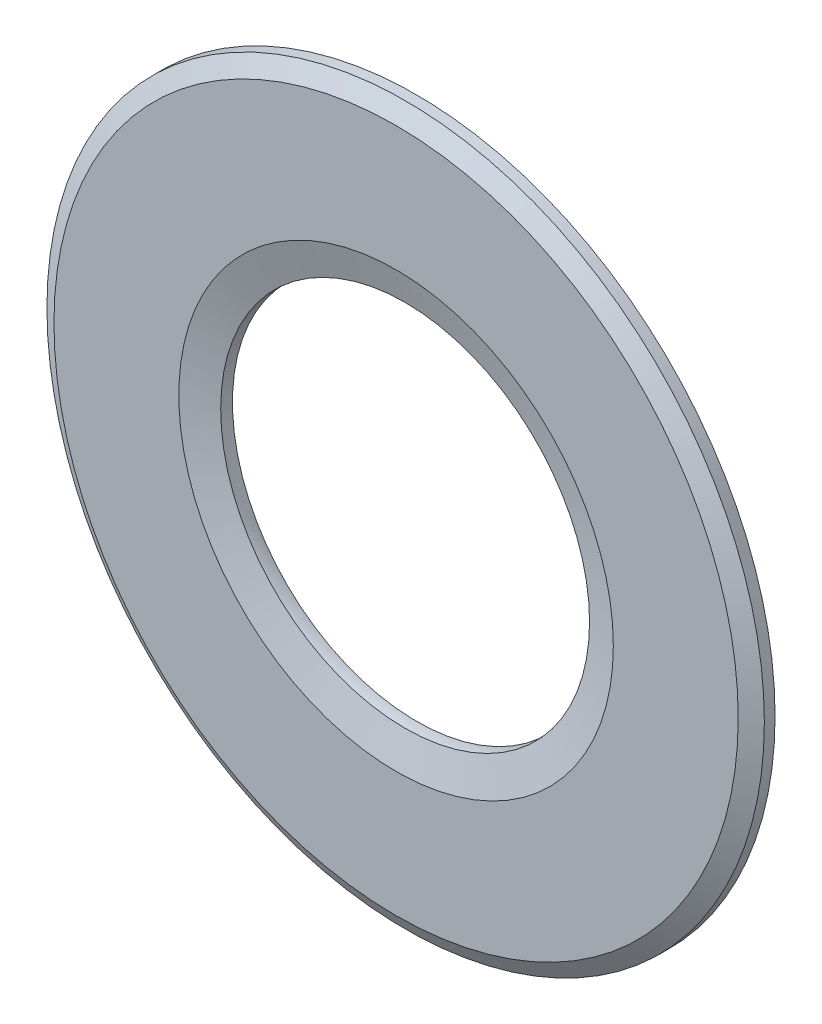
from build123d import *
from OCP.BRepFilletAPI import BRepFilletAPI_MakeChamfer

# Parameters (mm, degrees)
BOSS_EXTRUDE1_DEPTH      = 0.39624
BOSS_EXTRUDE1_DEPTH_BACK = 0.39624
SKETCH3_R                = 9.525
SKETCH3_R_2              = 4.8895
CHAMFER1_SIZE            = 0.254
CHAMFER1_SIZE2           = 0.439940905
CHAMFER2_SIZE            = 0.828943919


with BuildPart() as part:
    # Sketch3 → Boss-Extrude1 (new, two sides: drawn at the far end of the back side and taken through both)
    with BuildSketch(Plane.XY.offset(-BOSS_EXTRUDE1_DEPTH_BACK)):
        Circle(SKETCH3_R)
        Circle(SKETCH3_R_2, mode=Mode.SUBTRACT)
    extrude(amount=BOSS_EXTRUDE1_DEPTH + BOSS_EXTRUDE1_DEPTH_BACK)

    # Chamfer1: one chamfer whose edges measure the first distance from different faces: ONE call of the kernel's chamfer builder (chamfer() names one face for all edges)
    chamfer1_edges_1 = [part.edges().sort_by_distance(p)[0] for p in [
        (-9.525, 0, 0.39624),
    ]]
    chamfer1_side_1 = [part.faces().sort_by_distance(p)[0] for p in [
        (-9.525, 0, 0.19812),
    ]]
    chamfer1_edges_2 = [part.edges().sort_by_distance(p)[0] for p in [
        (-9.525, 0, -0.39624),
    ]]
    chamfer1_side_2 = [part.faces().sort_by_distance(p)[0] for p in [
        (-9.525, 0, -0.19812),
    ]]
    chamfer1 = BRepFilletAPI_MakeChamfer(part.part.solid().wrapped)
    for e in chamfer1_edges_1:
        chamfer1.Add(CHAMFER1_SIZE, CHAMFER1_SIZE2, e.wrapped, chamfer1_side_1[0].wrapped)  # the first distance lies on this face
    for e in chamfer1_edges_2:
        chamfer1.Add(CHAMFER1_SIZE, CHAMFER1_SIZE2, e.wrapped, chamfer1_side_2[0].wrapped)  # the first distance lies on this face
    add(Compound.cast(chamfer1.Shape()), mode=Mode.REPLACE)

    # Sketch4 → Cut-Revolve1 (revolve, cut)
    with BuildSketch(Plane(origin=(0, 0, 0), x_dir=(0, 0, -1), z_dir=(1, 0, 0)), mode=Mode.PRIVATE) as cut_revolve1_sk:
        with BuildLine():
            Line((-0.39624, 4.8387), (-0.39624, 4.9403))
            ThreePointArc((-0.39624, 4.9403), (0, 4.8895), (0.39624, 4.9403))
            Line((0.39624, 4.9403), (0.39624, 4.8387))
            Line((0.39624, 4.8387), (-0.39624, 4.8387))
        make_face()
    revolve(cut_revolve1_sk.sketch.rotate(Axis((0, 0, 0.39624), (0, 0, -1)), 90), axis=Axis((0, 0, 0.39624), (0, 0, -1)), mode=Mode.SUBTRACT)

    # Chamfer2
    # the kernel refuses this chamfer: 0.828943919, 0.254 mm, written as the material it takes off along each edge
    with BuildSketch(Plane(origin=(0, 0, -0.39624), x_dir=(1, 0, 0), z_dir=(0, 1, 0))) as chamfer2_piece_1:
        with BuildLine():
            Line((4.9403 + CHAMFER2_SIZE, 0), (4.897291135, -0.239987219))
            ThreePointArc((4.897291135, -0.239987219), (4.91289484, -0.126153132), (4.9403, 0))
            Line((4.9403, 0), (4.9403 + CHAMFER2_SIZE, 0))
        make_face()
    revolve(axis=Axis((0, 0, -0.39624), (0, 0, -1)), mode=Mode.SUBTRACT)
    with BuildSketch(Plane(origin=(0, 0, 0.39624), x_dir=(1, 0, 0), z_dir=(0, 1, 0))) as chamfer2_piece_2:
        with BuildLine():
            Line((4.9403 + CHAMFER2_SIZE, 0), (4.897291135, 0.239987219))
            ThreePointArc((4.897291135, 0.239987219), (4.91289484, 0.126153132), (4.9403, 0))
            Line((4.9403, 0), (4.9403 + CHAMFER2_SIZE, 0))
        make_face()
    revolve(axis=Axis((0, 0, 0.39624), (0, 0, -1)), mode=Mode.SUBTRACT)


solid = part.part
